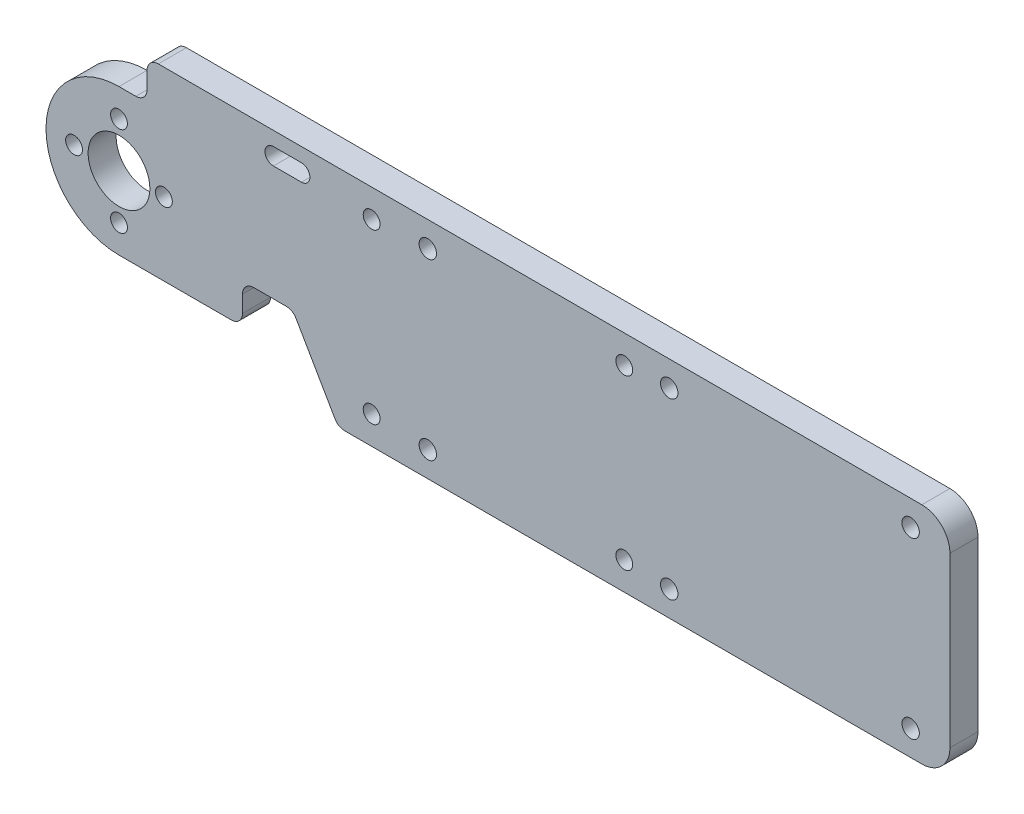
from build123d import *

# Parameters (mm, degrees)
SKETCH2_R           = 5.5
BOSS_EXTRUDE1_DEPTH = 2.5
FILLET1_R           = 5
SKETCH3_R           = 1.55
SKETCH3_R_2         = 1.5
CUT_EXTRUDE1_DEPTH  = 150.428912865
FILLET2_R           = 2


with BuildPart() as part:
    # Sketch2 → Boss-Extrude1 (new, symmetric)
    with BuildSketch(Plane.XY):
        with BuildLine():
            Line((5, 13), (0, 13))
            ThreePointArc((0, 13), (-13, 0), (0, -13))
            Line((0, -13), (22, -13))
            Line((22, -13), (22, -6))
            Line((22, -6), (30.958548116, -6))
            Line((30.958548116, -6), (39.041451884, -20))
            Line((39.041451884, -20), (148, -20))
            Line((148, -20), (148, 20))
            Line((148, 20), (5, 20))
            Line((5, 20), (5, 13))
        make_face()
        Circle(SKETCH2_R, mode=Mode.SUBTRACT)
    extrude(amount=BOSS_EXTRUDE1_DEPTH, both=True)

    # Fillet1
    fillet1_edges = [part.edges().sort_by_distance(p)[0] for p in [
        (148, -20, 0),
        (148, 20, 0),
    ]]
    fillet(fillet1_edges, radius=FILLET1_R)

    # Sketch3 → Cut-Extrude1 (cut, through all)
    with BuildSketch(Plane(origin=(0, 0, -2.5), x_dir=(-1, 0, 0), z_dir=(0, 0, -1))):
        with Locations((-98, 15.5)):
            Circle(SKETCH3_R)
        with Locations((-8, 0)):
            Circle(SKETCH3_R_2)
        with Locations((8, 0)):
            Circle(SKETCH3_R_2)
        with Locations((0, 8)):
            Circle(SKETCH3_R_2)
        with Locations((0, -8)):
            Circle(SKETCH3_R_2)
        with BuildLine():
            Line((-27.5, 17.5), (-32.5, 17.5))
            ThreePointArc((-32.5, 17.5), (-34, 16), (-32.5, 14.5))
            Line((-32.5, 14.5), (-27.5, 14.5))
            ThreePointArc((-27.5, 14.5), (-26, 16), (-27.5, 17.5))
        make_face()
        with Locations((-98, -15.5)):
            Circle(SKETCH3_R)
        with Locations((-55, -15.5)):
            Circle(SKETCH3_R)
        with Locations((-55, 15.5)):
            Circle(SKETCH3_R)
        with Locations((-141, -15.5)):
            Circle(SKETCH3_R)
        with Locations((-141, 15.5)):
            Circle(SKETCH3_R)
        with Locations((-90, -15)):
            Circle(SKETCH3_R_2)
        with Locations((-45, -15)):
            Circle(SKETCH3_R_2)
        with Locations((-90, 15)):
            Circle(SKETCH3_R_2)
        with Locations((-45, 15)):
            Circle(SKETCH3_R_2)
    extrude(amount=-CUT_EXTRUDE1_DEPTH, mode=Mode.SUBTRACT)

    # Fillet2
    fillet2_edges = [part.edges().sort_by_distance(p)[0] for p in [
        (5, 20, 0),
        (5, 13, 0),
        (22, -13, 0),
        (22, -6, 0),
        (39.041451884, -20, 0),
        (30.958548116, -6, 0),
    ]]
    fillet(fillet2_edges, radius=FILLET2_R)


solid = part.part
